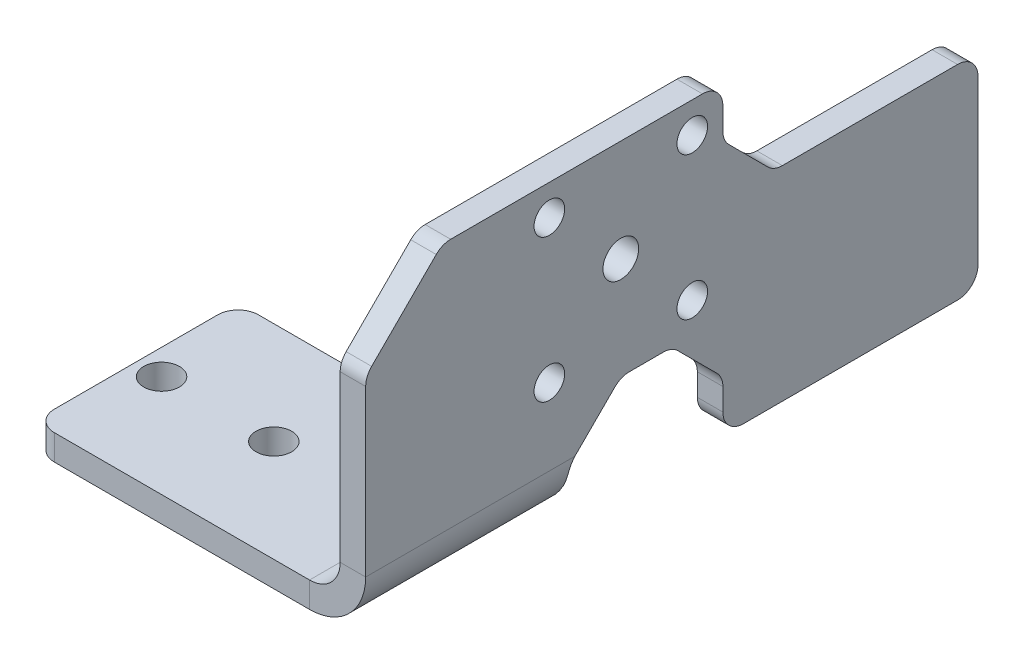
from build123d import *

# Parameters (mm, degrees)
T_LE_DE_BASE_PLI_E1_DEPTH    = 40
BOSS_EXTRU_1_DEPTH           = 5
ENL_V_MAT_EXTRU_1_DEPTH      = 117.833214455
ENL_V_MAT_EXTRU_1_DEPTH_BACK = 117.833214455
ESQUISSE8_R                  = 3.5
ESQUISSE8_R_2                = 3
ESQUISSE10_W                 = 50
ESQUISSE10_H                 = 20
BOSS_EXTRU_2_DEPTH           = 5
ENL_V_MAT_EXTRU_2_DEPTH      = 117.833214455
ENL_V_MAT_EXTRU_2_DEPTH_BACK = 117.833214455
ESQUISSE9_R                  = 3.5
ENL_V_MAT_EXTRU_3_DEPTH      = 115.127122105
ENL_V_MAT_EXTRU_3_DEPTH_BACK = 115.127122105
ESQUISSE11_W                 = 50
ESQUISSE11_H                 = 20
CHANFREIN1_SIZE              = 10
CONG_1_R                     = 4


# Read off the part's stored shape, not the designer's step: Tôle de base pliée1
with BuildPart() as part:
    # Tôle de base pliée1 outline → Tôle de base pliée1 (new body)
    with BuildSketch(Plane.XY):
        with BuildLine():
            Line((65, 6), (65, 40))
            Line((65, 40), (60, 40))
            Line((60, 40), (60, 6))
            ThreePointArc((60, 6), (58.242640687, 1.757359313), (54, 0))
            Line((54, 0), (0, 0))
            Line((0, 0), (0, -5))
            Line((0, -5), (54, -5))
            ThreePointArc((54, -5), (61.778174593, -1.778174593), (65, 6))
        make_face()
    extrude(amount=T_LE_DE_BASE_PLI_E1_DEPTH)

    # Esquisse7 → Boss.-Extru.1 (add)
    with BuildSketch(Plane.ZY.offset(-60)):
        Polygon((25, 55), (-80, 55), (-80, 15), (0, 15), (40, 40), align=None)
    extrude(amount=-BOSS_EXTRU_1_DEPTH)

    # Esquisse8 → Enlèv. mat.-Extru.1 (cut, two sides: drawn at the far end of the back side and taken through both)
    with BuildSketch(Plane(origin=(65, 0, 0), x_dir=(0, 0, -1), z_dir=(1, 0, 0)).offset(-ENL_V_MAT_EXTRU_1_DEPTH_BACK)):
        with Locations(Location((10, 35, 0), (0, 0, 180))):
            Circle(ESQUISSE8_R)
        with Locations(Location((24, 49, 0), (0, 0, 180))):
            Circle(ESQUISSE8_R_2)
        with Locations(Location((24, 21, 0), (0, 0, 180))):
            Circle(ESQUISSE8_R_2)
        with Locations(Location((-4, 21, 0), (0, 0, 180))):
            Circle(ESQUISSE8_R_2)
        with Locations(Location((-4, 49, 0), (0, 0, 180))):
            Circle(ESQUISSE8_R_2)
    extrude(amount=ENL_V_MAT_EXTRU_1_DEPTH + ENL_V_MAT_EXTRU_1_DEPTH_BACK, mode=Mode.SUBTRACT)

    # Esquisse10 → Boss.-Extru.2 (add)
    with BuildSketch(Plane.ZY.offset(-60)):
        with Locations((-55, 5)):
            Rectangle(ESQUISSE10_W, ESQUISSE10_H)
    extrude(amount=-BOSS_EXTRU_2_DEPTH)

    # Esquisse9 → Enlèv. mat.-Extru.2 (cut, two sides: drawn at the far end of the back side and taken through both)
    with BuildSketch(Plane(origin=(0, 0, 0), x_dir=(1, 0, 0), z_dir=(0, 1, 0)).offset(-ENL_V_MAT_EXTRU_2_DEPTH_BACK)):
        with Locations(Location((5, -20, 0), (0, 0, 270))):
            Circle(ESQUISSE9_R)
        with Locations(Location((27, -20, 0), (0, 0, 270))):
            Circle(ESQUISSE9_R)
        with Locations(Location((49, -20, 0), (0, 0, 270))):
            Circle(ESQUISSE9_R)
    extrude(amount=ENL_V_MAT_EXTRU_2_DEPTH + ENL_V_MAT_EXTRU_2_DEPTH_BACK, mode=Mode.SUBTRACT)

    # Esquisse11 → Enlèv. mat.-Extru.3 (cut, two sides: drawn at the far end of the back side and taken through both)
    with BuildSketch(Plane.ZY.offset(-60).offset(-ENL_V_MAT_EXTRU_3_DEPTH_BACK)):
        with Locations((-55, 45)):
            Rectangle(ESQUISSE11_W, ESQUISSE11_H)
    extrude(amount=ENL_V_MAT_EXTRU_3_DEPTH + ENL_V_MAT_EXTRU_3_DEPTH_BACK, mode=Mode.SUBTRACT)

    # Chanfrein1
    chanfrein1_edges = [part.edges().sort_by_distance(p)[0] for p in [
        (62.5, 15, 0),
        (62.5, 15, -30),
        (62.5, 35, -30),
    ]]
    chamfer(chanfrein1_edges, length=CHANFREIN1_SIZE)

    # Congé1
    cong_1_edges = [part.edges().sort_by_distance(p)[0] for p in [
        (62.5, 55, -30),
        (62.5, 35, -80),
        (62.5, 35, -40),
        (62.5, 45, -30),
        (62.5, 5, -30),
        (62.5, 15, -10),
        (62.5, 15, -20),
        (62.435265467, 5, 0),
        (0, -2.5, 40),
        (62.5, 55, 25),
        (62.5, 40, 40),
        (0, -2.5, 0),
        (62.5, -5, -80),
        (62.5, -5, -30),
    ]]
    fillet(cong_1_edges, radius=CONG_1_R)


solid = part.part
